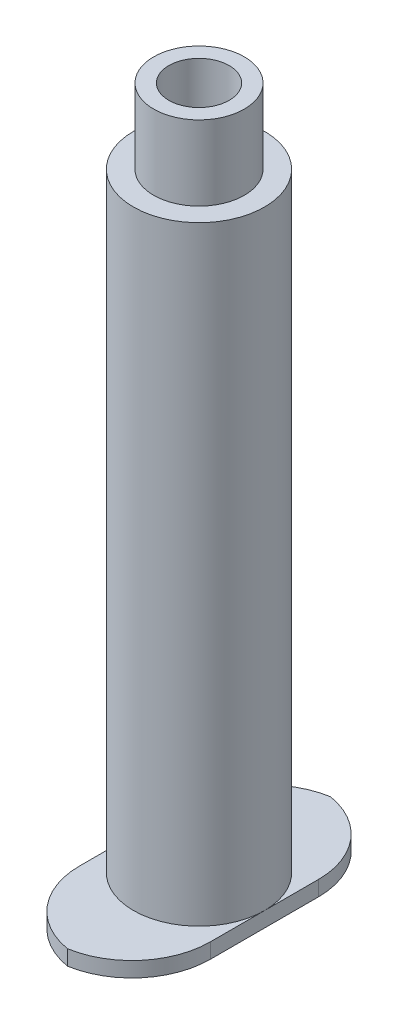
from build123d import *

# Parameters (mm, degrees)
CROQUIS1_R              = 6.67
SALIENTE_EXTRUIR1_DEPTH = 62
CROQUIS2_R              = 4.61
SALIENTE_EXTRUIR2_DEPTH = 7.6
CROQUIS3_R              = 5.13
CORTAR_EXTRUIR1_DEPTH   = 60.6
CROQUIS4_R              = 3.07
CORTAR_EXTRUIR2_DEPTH   = 60.6
SALIENTE_EXTRUIR3_START = 1.54
CROQUIS5_W              = 13.34
CROQUIS5_H              = 27
CROQUIS5_R              = 5.13
SALIENTE_EXTRUIR3_DEPTH = 1.54
REDONDEO1_R             = 8


with BuildPart() as part:
    # Croquis1 → Saliente-Extruir1 (new body)
    with BuildSketch(Plane(origin=(0, 0, 0), x_dir=(1, 0, 0), z_dir=(0, 1, 0))):
        with Locations(Location((0, 0, 0), (0, 0, 270))):
            Circle(CROQUIS1_R)
    extrude(amount=SALIENTE_EXTRUIR1_DEPTH)

    # Croquis2 → Saliente-Extruir2 (add)
    with BuildSketch(Plane(origin=(0, 62, 0), x_dir=(1, 0, 0), z_dir=(0, 1, 0))):
        with Locations(Location((0, 0, 0), (0, 0, 90))):
            Circle(CROQUIS2_R)
    extrude(amount=SALIENTE_EXTRUIR2_DEPTH)

    # Croquis3 → Cortar-Extruir1 (cut)
    with BuildSketch(Plane.XZ):
        with Locations(Location((0, 0, 0), (0, 0, 270))):
            Circle(CROQUIS3_R)
    extrude(amount=-CORTAR_EXTRUIR1_DEPTH, mode=Mode.SUBTRACT)

    # Croquis4 → Cortar-Extruir2 (cut)
    with BuildSketch(Plane(origin=(0, 69.6, 0), x_dir=(1, 0, 0), z_dir=(0, 1, 0))):
        with Locations(Location((0, 0, 0), (0, 0, 270))):
            Circle(CROQUIS4_R)
    extrude(amount=-CORTAR_EXTRUIR2_DEPTH, mode=Mode.SUBTRACT)

    # Croquis5 → Saliente-Extruir3 (add)
    with BuildSketch(Plane.XZ.offset(SALIENTE_EXTRUIR3_START)):
        Rectangle(CROQUIS5_W, CROQUIS5_H)
        with Locations(Location((0, 0, 0), (0, 0, 270))):
            Circle(CROQUIS5_R, mode=Mode.SUBTRACT)
    extrude(amount=-SALIENTE_EXTRUIR3_DEPTH)

    # Redondeo1
    # the kernel refuses this fillet: 8 mm, written as the material it takes off along each edge
    with BuildSketch(Plane(origin=(-6.67, -21.54, -13.5), x_dir=(0, 0, 1), z_dir=(0, 1, 0)), Plane(origin=(6.67, -21.54, -13.5), x_dir=(-1, 0, 0), z_dir=(0, 1, 0)), Plane(origin=(6.67, -21.54, 13.5), x_dir=(0, 0, -1), z_dir=(0, 1, 0))) as redondeo1_piece_1:
        with BuildLine():
            CenterArc((REDONDEO1_R, REDONDEO1_R), REDONDEO1_R, 180, 90)
            Line((0, REDONDEO1_R), (0, 0))
            Line((0, 0), (REDONDEO1_R, 0))
        make_face()
    extrude(amount=41.54, mode=Mode.SUBTRACT)
    with BuildSketch(Plane(origin=(-6.67, -21.54, 13.5), x_dir=(0, 0, -1), z_dir=(0, 1, 0))) as redondeo1_piece_2:
        with BuildLine():
            CenterArc((REDONDEO1_R, -REDONDEO1_R), REDONDEO1_R, 90, 90)
            Line((0, -REDONDEO1_R), (0, 0))
            Line((0, 0), (REDONDEO1_R, 0))
        make_face()
    extrude(amount=41.54, mode=Mode.SUBTRACT)


solid = part.part
